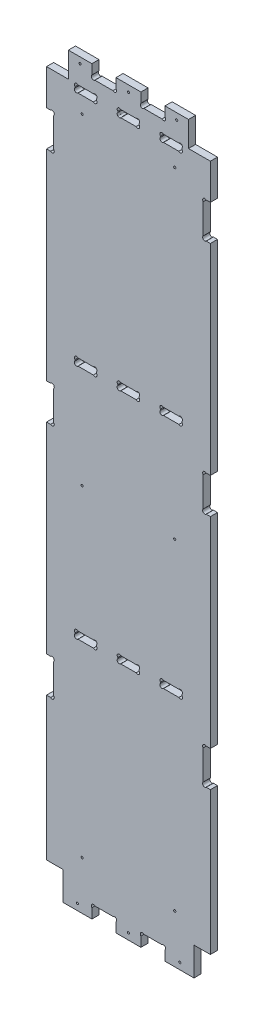
from build123d import *

# Parameters (mm, degrees)
BOSS_EXTRUDE1_DEPTH          = 10
SKETCH2_W                    = 33.8
SKETCH2_H                    = 18
CUT_EXTRUDE1_DEPTH           = 38
SKETCH3_W                    = 23
SKETCH3_H                    = 40.02
CUT_EXTRUDE2_DEPTH           = 51
CAVITY1_START                = -212
CAVITY1_OUTLINE_W            = 50
CAVITY1_OUTLINE_H            = 10
CAVITY1_DEPTH                = 10
CAVITY1_START_2              = 8
CAVITY1_2_OUTLINE_W          = 50
CAVITY1_2_OUTLINE_H          = 10
CAVITY1_2_DEPTH              = 10
CAVITY1_START_3              = -172
CAVITY1_3_OUTLINE_W          = 10
CAVITY1_3_OUTLINE_H          = 10
CAVITY1_3_DEPTH              = 30
CAVITY1_START_4              = -112
CAVITY1_4_OUTLINE_W          = 10
CAVITY1_4_OUTLINE_H          = 10
CAVITY1_4_DEPTH              = 30
CAVITY1_START_5              = -52
CAVITY1_5_OUTLINE_W          = 10
CAVITY1_5_OUTLINE_H          = 10
CAVITY1_5_DEPTH              = 30
F_3_0_3_DIAMETER_HOLE1_D     = 3
F_3_0_3_DIAMETER_HOLE1_DEPTH = 15
F_3_0_3_DIAMETER_HOLE1_TIP   = 0.901290929
SKETCH6_R                    = 3
CUT_EXTRUDE3_DEPTH           = 1062.376089612
CAVITY2_START                = 8
CAVITY2_OUTLINE_W            = 50
CAVITY2_OUTLINE_H            = 10
CAVITY2_DEPTH                = 10


# Read off the part's stored shape, not the designer's step: Cavity1, Cavity2
with BuildPart() as part:
    # Sketch1 → Boss-Extrude1 (new body)
    with BuildSketch(Plane.XY):
        Polygon((18, -35.36), (-12.7, -35.36), (-12.7, 0), (-181.3, 0), (-181.3, -35.36), (-212, -35.36), (-212, -1039.94), (18, -1039.94), align=None)
    extrude(amount=-BOSS_EXTRUDE1_DEPTH)

    # Sketch2 → Cut-Extrude1 (cut)
    with BuildSketch(Plane.XY):
        with Locations((-62.6, -9)):
            Rectangle(SKETCH2_W, SKETCH2_H)
        with Locations((-131.4, -9)):
            Rectangle(SKETCH2_W, SKETCH2_H)
        with Locations((-131.4, -1030.94)):
            Rectangle(SKETCH2_W, SKETCH2_H)
        with Locations((-62.6, -1030.94)):
            Rectangle(SKETCH2_W, SKETCH2_H)
    extrude(amount=-CUT_EXTRUDE1_DEPTH, mode=Mode.SUBTRACT)

    # Sketch3 → Cut-Extrude2 (cut)
    with BuildSketch(Plane.XY):
        with Locations((-200.5, -1019.93)):
            Rectangle(SKETCH3_W, SKETCH3_H)
        with Locations((6.5, -1019.93)):
            Rectangle(SKETCH3_W, SKETCH3_H)
    extrude(amount=-CUT_EXTRUDE2_DEPTH, mode=Mode.SUBTRACT)

    # Cavity1 outline → Cavity1 (cut)
    with BuildSketch(Plane.YZ.offset(CAVITY1_START)):
        with Locations((-110.46, -5)):
            Rectangle(CAVITY1_OUTLINE_W, CAVITY1_OUTLINE_H)
        with Locations((-442.46, -5)):
            Rectangle(CAVITY1_OUTLINE_W, CAVITY1_OUTLINE_H)
        with Locations((-774.46, -5)):
            Rectangle(CAVITY1_OUTLINE_W, CAVITY1_OUTLINE_H)
    extrude(amount=CAVITY1_DEPTH, mode=Mode.SUBTRACT)

    # Cavity1 2 outline → Cavity1 2 (cut)
    with BuildSketch(Plane.YZ.offset(CAVITY1_START_2)):
        with Locations((-442.46, -5)):
            Rectangle(CAVITY1_2_OUTLINE_W, CAVITY1_2_OUTLINE_H)
        with Locations((-774.46, -5)):
            Rectangle(CAVITY1_2_OUTLINE_W, CAVITY1_2_OUTLINE_H)
    extrude(amount=CAVITY1_2_DEPTH, mode=Mode.SUBTRACT)

    # Cavity1 3 outline → Cavity1 3 (cut)
    with BuildSketch(Plane.YZ.offset(CAVITY1_START_3)):
        with Locations((-40.46, -5)):
            Rectangle(CAVITY1_3_OUTLINE_W, CAVITY1_3_OUTLINE_H)
        with Locations((-372.46, -5)):
            Rectangle(CAVITY1_3_OUTLINE_W, CAVITY1_3_OUTLINE_H)
        with Locations((-704.46, -5)):
            Rectangle(CAVITY1_3_OUTLINE_W, CAVITY1_3_OUTLINE_H)
    extrude(amount=CAVITY1_3_DEPTH, mode=Mode.SUBTRACT)

    # Cavity1 4 outline → Cavity1 4 (cut)
    with BuildSketch(Plane.YZ.offset(CAVITY1_START_4)):
        with Locations((-40.46, -5)):
            Rectangle(CAVITY1_4_OUTLINE_W, CAVITY1_4_OUTLINE_H)
        with Locations((-372.46, -5)):
            Rectangle(CAVITY1_4_OUTLINE_W, CAVITY1_4_OUTLINE_H)
        with Locations((-704.46, -5)):
            Rectangle(CAVITY1_4_OUTLINE_W, CAVITY1_4_OUTLINE_H)
    extrude(amount=CAVITY1_4_DEPTH, mode=Mode.SUBTRACT)

    # Cavity1 5 outline → Cavity1 5 (cut)
    with BuildSketch(Plane.YZ.offset(CAVITY1_START_5)):
        with Locations((-40.46, -5)):
            Rectangle(CAVITY1_5_OUTLINE_W, CAVITY1_5_OUTLINE_H)
        with Locations((-372.46, -5)):
            Rectangle(CAVITY1_5_OUTLINE_W, CAVITY1_5_OUTLINE_H)
        with Locations((-704.46, -5)):
            Rectangle(CAVITY1_5_OUTLINE_W, CAVITY1_5_OUTLINE_H)
    extrude(amount=CAVITY1_5_DEPTH, mode=Mode.SUBTRACT)

    # Ø3.0 (3) Diameter Hole1
    with Locations(Plane(origin=(0, 0, -10), x_dir=(-1, 0, 0), z_dir=(0, 0, -1))):
        with Locations((162, -971.94), (32, -68), (162, -68), (32, -971.94), (32, -519.97), (162, -519.97), (97, -1030.94), (168.65, -1030.94), (29.2, -9), (164.8, -8.474913611), (97, -8.985510412), (24.929428347, -1030.94)):
            Hole(F_3_0_3_DIAMETER_HOLE1_D / 2, depth=F_3_0_3_DIAMETER_HOLE1_DEPTH)
            with Locations((0, 0, -(F_3_0_3_DIAMETER_HOLE1_DEPTH + F_3_0_3_DIAMETER_HOLE1_TIP / 2))):  # 118° drill point
                Cone(0, F_3_0_3_DIAMETER_HOLE1_D / 2, F_3_0_3_DIAMETER_HOLE1_TIP, mode=Mode.SUBTRACT)

    # Sketch6 → Cut-Extrude3 (cut, through all)
    with BuildSketch(Plane.XY):
        with Locations((-77.378679656, -15.878679656)):
            Circle(SKETCH6_R)
        with Locations((-204.121320344, -133.338679656)):
            Circle(SKETCH6_R)
        with Locations((-146.178679656, -15.878679656)):
            Circle(SKETCH6_R)
        with Locations((10.121320344, -465.338679656)):
            Circle(SKETCH6_R)
        with Locations((10.121320344, -797.338679656)):
            Circle(SKETCH6_R)
        with Locations((-47.821320344, -1024.061320344)):
            Circle(SKETCH6_R)
        with Locations((-116.621320344, -1024.061320344)):
            Circle(SKETCH6_R)
        with Locations((-146.178679656, -1024.061320344)):
            Circle(SKETCH6_R)
        with Locations((-77.378679656, -1024.061320344)):
            Circle(SKETCH6_R)
        with Locations((-204.121320344, -751.581320344)):
            Circle(SKETCH6_R)
        with Locations((-204.121320344, -797.338679656)):
            Circle(SKETCH6_R)
        with Locations((10.121320344, -751.581320344)):
            Circle(SKETCH6_R)
        with Locations((-204.121320344, -465.338679656)):
            Circle(SKETCH6_R)
        with Locations((-204.121320344, -419.603746587)):
            Circle(SKETCH6_R)
        with Locations((10.121320344, -419.581320344)):
            Circle(SKETCH6_R)
        with Locations((-204.121320344, -87.581320344)):
            Circle(SKETCH6_R)
        with Locations((-116.621320344, -15.878679656)):
            Circle(SKETCH6_R)
        with Locations((-47.821320344, -15.878679656)):
            Circle(SKETCH6_R)
        with Locations((10.121320344, -133.338679656)):
            Circle(SKETCH6_R)
        with Locations((10.121320344, -87.581320344)):
            Circle(SKETCH6_R)
        with BuildLine():
            ThreePointArc((-169.034165929, -40.46), (-169.878679656, -34.581320344), (-170.723193384, -40.46))
            ThreePointArc((-170.723193384, -40.46), (-169.878679656, -46.338679656), (-169.034165929, -40.46))
        make_face()
        with BuildLine():
            ThreePointArc((-143.276806616, -40.46), (-144.121320344, -34.581320344), (-144.965834071, -40.46))
            ThreePointArc((-144.965834071, -40.46), (-144.121320344, -46.338679656), (-143.276806616, -40.46))
        make_face()
        with BuildLine():
            ThreePointArc((-109.000072619, -40.46), (-109.844586347, -34.581320344), (-110.689100074, -40.46))
            ThreePointArc((-110.689100074, -40.46), (-109.844586347, -46.338679656), (-109.000072619, -40.46))
        make_face()
        with BuildLine():
            ThreePointArc((-83.276806616, -40.46), (-84.121320344, -34.581320344), (-84.965834071, -40.46))
            ThreePointArc((-84.965834071, -40.46), (-84.121320344, -46.338679656), (-83.276806616, -40.46))
        make_face()
        with BuildLine():
            ThreePointArc((-49.034165929, -40.46), (-49.878679656, -34.581320344), (-50.723193384, -40.46))
            ThreePointArc((-50.723193384, -40.46), (-49.878679656, -46.338679656), (-49.034165929, -40.46))
        make_face()
        with BuildLine():
            ThreePointArc((-23.334221965, -40.443774452), (-24.28995876, -34.581876494), (-25.019293883, -40.476225548))
            ThreePointArc((-25.019293883, -40.476225548), (-24.063557088, -46.338123506), (-23.334221965, -40.443774452))
        make_face()
        with BuildLine():
            ThreePointArc((-23.334221965, -372.443774452), (-24.28995876, -366.581876494), (-25.019293883, -372.476225548))
            ThreePointArc((-25.019293883, -372.476225548), (-24.063557088, -378.338123506), (-23.334221965, -372.443774452))
        make_face()
        with BuildLine():
            ThreePointArc((-49.034165929, -372.46), (-49.878679656, -366.581320344), (-50.723193384, -372.46))
            ThreePointArc((-50.723193384, -372.46), (-49.878679656, -378.338679656), (-49.034165929, -372.46))
        make_face()
        with BuildLine():
            ThreePointArc((-109.034165929, -372.46), (-109.878679656, -366.581320344), (-110.723193384, -372.46))
            ThreePointArc((-110.723193384, -372.46), (-109.878679656, -378.338679656), (-109.034165929, -372.46))
        make_face()
        with BuildLine():
            ThreePointArc((-83.276806616, -372.46), (-84.121320344, -366.581320344), (-84.965834071, -372.46))
            ThreePointArc((-84.965834071, -372.46), (-84.121320344, -378.338679656), (-83.276806616, -372.46))
        make_face()
        with BuildLine():
            ThreePointArc((-143.276806616, -372.46), (-144.121320344, -366.581320344), (-144.965834071, -372.46))
            ThreePointArc((-144.965834071, -372.46), (-144.121320344, -378.338679656), (-143.276806616, -372.46))
        make_face()
        with BuildLine():
            ThreePointArc((-169.034165929, -372.46), (-169.878679656, -366.581320344), (-170.723193384, -372.46))
            ThreePointArc((-170.723193384, -372.46), (-169.878679656, -378.338679656), (-169.034165929, -372.46))
        make_face()
        with BuildLine():
            ThreePointArc((-170.723193384, -704.46), (-169.878679656, -710.338679656), (-169.034165929, -704.46))
            ThreePointArc((-169.034165929, -704.46), (-169.878679656, -698.581320344), (-170.723193384, -704.46))
        make_face()
        with BuildLine():
            ThreePointArc((-143.266779368, -704.462960664), (-144.121320344, -698.587241672), (-144.975861319, -704.462960664))
            ThreePointArc((-144.975861319, -704.462960664), (-144.121320344, -710.338679656), (-143.266779368, -704.462960664))
        make_face()
        with BuildLine():
            ThreePointArc((-110.723193384, -704.46), (-109.878679656, -710.338679656), (-109.034165929, -704.46))
            ThreePointArc((-109.034165929, -704.46), (-109.878679656, -698.581320344), (-110.723193384, -704.46))
        make_face()
        with BuildLine():
            ThreePointArc((-83.266779368, -704.462960664), (-84.121320344, -698.587241672), (-84.975861319, -704.462960664))
            ThreePointArc((-84.975861319, -704.462960664), (-84.121320344, -710.338679656), (-83.266779368, -704.462960664))
        make_face()
        with BuildLine():
            ThreePointArc((-50.723193384, -704.465921329), (-49.878679656, -710.344600985), (-49.034165929, -704.465921329))
            ThreePointArc((-49.034165929, -704.465921329), (-49.878679656, -698.587241672), (-50.723193384, -704.465921329))
        make_face()
        with BuildLine():
            ThreePointArc((-23.266779368, -704.468881993), (-24.121320344, -698.593163001), (-24.975861319, -704.468881993))
            ThreePointArc((-24.975861319, -704.468881993), (-24.121320344, -710.344600985), (-23.266779368, -704.468881993))
        make_face()
    extrude(amount=-CUT_EXTRUDE3_DEPTH, mode=Mode.SUBTRACT)

    # Cavity2 outline → Cavity2 (cut)
    with BuildSketch(Plane.YZ.offset(CAVITY2_START)):
        with Locations((-110.46, -5)):
            Rectangle(CAVITY2_OUTLINE_W, CAVITY2_OUTLINE_H)
    extrude(amount=CAVITY2_DEPTH, mode=Mode.SUBTRACT)


solid = part.part
